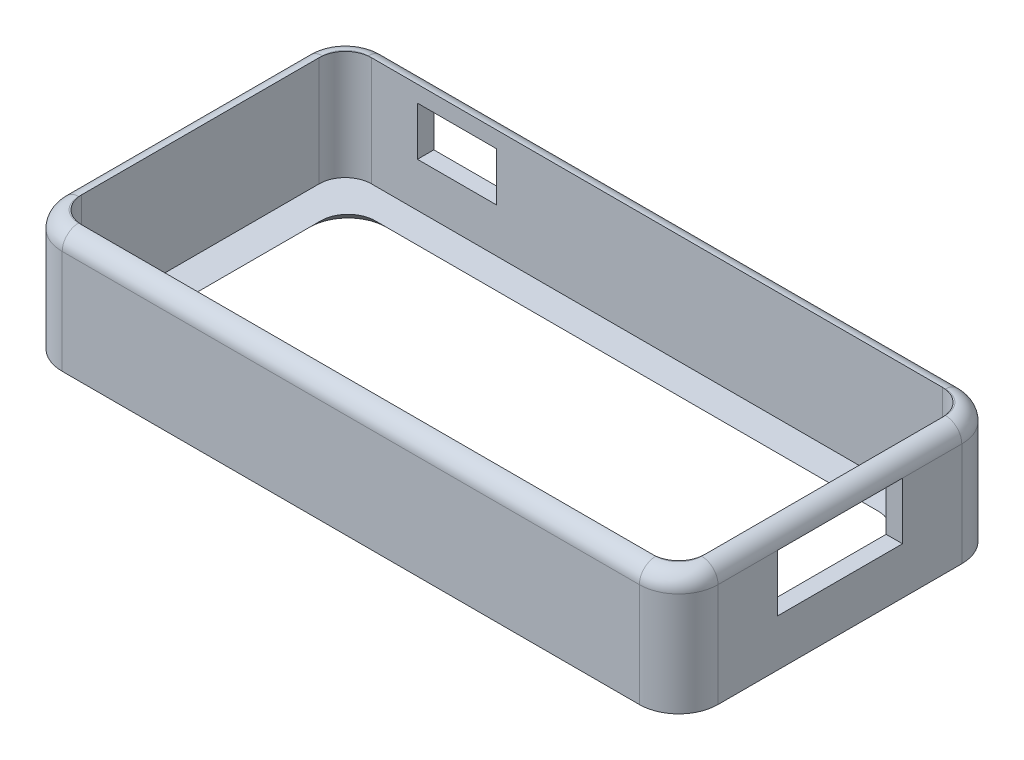
from build123d import *

# Parameters (mm, degrees)
SALIENTE_EXTRUIR2_DEPTH = 22
SALIENTE_EXTRUIR3_DEPTH = 2
CORTAR_EXTRUIR1_DEPTH   = 2
CHAFL_N1_SIZE           = 3
REDONDEO2_R             = 3
CROQUIS4_W              = 22.9
CROQUIS4_H              = 10.4
CORTAR_EXTRUIR2_DEPTH   = 10
CROQUIS5_W              = 14.5
CROQUIS5_H              = 8.9
CORTAR_EXTRUIR3_DEPTH   = 10


# Some blends are built 0.0001 mm under size
with BuildPart() as part:
    # Croquis1 → Saliente-Extruir2 (new body)
    with BuildSketch(Plane(origin=(0, 0, 0), x_dir=(1, 0, 0), z_dir=(0, 1, 0))):
        with BuildLine():
            Line((-52.8, 29.5), (52.8, 29.5))
            ThreePointArc((52.8, 29.5), (57.891168825, 27.391168825), (60, 22.3))
            Line((60, 22.3), (60, -22.3))
            ThreePointArc((60, -22.3), (57.891168825, -27.391168825), (52.8, -29.5))
            Line((52.8, -29.5), (-52.8, -29.5))
            ThreePointArc((-52.8, -29.5), (-57.891168825, -27.391168825), (-60, -22.3))
            Line((-60, -22.3), (-60, 22.3))
            ThreePointArc((-60, 22.3), (-57.891168825, 27.391168825), (-52.8, 29.5))
        make_face()
        with BuildLine():
            Line((-52.225351705, 26.5), (52.225351705, 26.5))
            ThreePointArc((52.225351705, 26.5), (55.601537892, 25.101537892), (57, 21.725351705))
            Line((57, 21.725351705), (57, -21.725351705))
            ThreePointArc((57, -21.725351705), (55.601537892, -25.101537892), (52.225351705, -26.5))
            Line((52.225351705, -26.5), (-52.225351705, -26.5))
            ThreePointArc((-52.225351705, -26.5), (-55.601537892, -25.101537892), (-57, -21.725351705))
            Line((-57, -21.725351705), (-57, 21.725351705))
            ThreePointArc((-57, 21.725351705), (-55.601537892, 25.101537892), (-52.225351705, 26.5))
        make_face(mode=Mode.SUBTRACT)
    extrude(amount=SALIENTE_EXTRUIR2_DEPTH)

    # Croquis2 → Saliente-Extruir3 (add)
    with BuildSketch(Plane.XZ):
        with BuildLine():
            Line((-60, 22.3), (-60, -22.3))
            ThreePointArc((-60, -22.3), (-57.891168825, -27.391168825), (-52.8, -29.5))
            Line((-52.8, -29.5), (52.8, -29.5))
            ThreePointArc((52.8, -29.5), (57.891168825, -27.391168825), (60, -22.3))
            Line((60, -22.3), (60, 22.3))
            ThreePointArc((60, 22.3), (57.891168825, 27.391168825), (52.8, 29.5))
            Line((52.8, 29.5), (-52.8, 29.5))
            ThreePointArc((-52.8, 29.5), (-57.891168825, 27.391168825), (-60, 22.3))
        make_face()
    extrude(amount=-SALIENTE_EXTRUIR3_DEPTH)

    # Croquis3 → Cortar-Extruir1 (cut)
    with BuildSketch(Plane(origin=(0, 2, 0), x_dir=(1, 0, 0), z_dir=(0, 1, 0))):
        with BuildLine():
            Line((-46, 20), (46, 20))
            ThreePointArc((46, 20), (48.828427125, 18.828427125), (50, 16))
            Line((50, 16), (50, -16))
            ThreePointArc((50, -16), (48.828427125, -18.828427125), (46, -20))
            Line((46, -20), (-46, -20))
            ThreePointArc((-46, -20), (-48.828427125, -18.828427125), (-50, -16))
            Line((-50, -16), (-50, 16))
            ThreePointArc((-50, 16), (-48.828427125, 18.828427125), (-46, 20))
        make_face()
    extrude(amount=-CORTAR_EXTRUIR1_DEPTH, mode=Mode.SUBTRACT)

    # Chaflán1
    # the kernel refuses this chamfer: 3 mm, written as the material it takes off along each edge
    with BuildSketch(Plane(origin=(-50, 0, 16), x_dir=(-0.9996219169112968, -0.02749587661058636, 0), z_dir=(0, 0, -1)), Plane(origin=(50, 0, -16), x_dir=(0.9996219169112968, -0.02749587661058636, 0), z_dir=(0, 0, 1))) as chafl_n1_piece_1:
        Polygon((CHAFL_N1_SIZE * 0.999621916911, CHAFL_N1_SIZE * 0.0274958766106), (-CHAFL_N1_SIZE * 0.0274958766106, CHAFL_N1_SIZE * 0.999621916911), (0, 0), align=None)
    extrude(amount=32, mode=Mode.SUBTRACT)
    with BuildSketch(Plane(origin=(-46, 0, 16), x_dir=(0, 0, 1), z_dir=(1, 0, 0))) as chafl_n1_piece_2:
        Polygon((4 + CHAFL_N1_SIZE, 0), (4, -CHAFL_N1_SIZE), (4, 0), align=None)
    revolve(axis=Axis((-46, 0, 16), (0, -1, 0)), revolution_arc=90, mode=Mode.SUBTRACT)
    with BuildSketch(Plane(origin=(-46, 0, -16), x_dir=(-1, 0, 0), z_dir=(0, 0, 1))) as chafl_n1_piece_3:
        Polygon((4 + CHAFL_N1_SIZE, 0), (4, -CHAFL_N1_SIZE), (4, 0), align=None)
    revolve(axis=Axis((-46, 0, -16), (0, -1, 0)), revolution_arc=90, mode=Mode.SUBTRACT)
    with BuildSketch(Plane(origin=(46, 0, 20), x_dir=(0, -0.02749587661058636, 0.9996219169112968), z_dir=(-1, 0, 0)), Plane(origin=(-46, 0, -20), x_dir=(0, -0.02749587661058636, -0.9996219169112968), z_dir=(1, 0, 0))) as chafl_n1_piece_4:
        Polygon((CHAFL_N1_SIZE * 0.999621916911, CHAFL_N1_SIZE * 0.0274958766106), (-CHAFL_N1_SIZE * 0.0274958766106, CHAFL_N1_SIZE * 0.999621916911), (0, 0), align=None)
    extrude(amount=92, mode=Mode.SUBTRACT)
    with BuildSketch(Plane(origin=(46, 0, 16), x_dir=(1, 0, 0), z_dir=(0, 0, -1))) as chafl_n1_piece_5:
        Polygon((4 + CHAFL_N1_SIZE, 0), (4, -CHAFL_N1_SIZE), (4, 0), align=None)
    revolve(axis=Axis((46, 0, 16), (0, -1, 0)), revolution_arc=90, mode=Mode.SUBTRACT)
    with BuildSketch(Plane(origin=(46, 0, -16), x_dir=(0, 0, -1), z_dir=(-1, 0, 0))) as chafl_n1_piece_6:
        Polygon((4 + CHAFL_N1_SIZE, 0), (4, -CHAFL_N1_SIZE), (4, 0), align=None)
    revolve(axis=Axis((46, 0, -16), (0, -1, 0)), revolution_arc=90, mode=Mode.SUBTRACT)

    # Redondeo2
    redondeo2_edges = [part.edges().sort_by_distance(p)[0] for p in [
        (57.891168825, 22, 27.391168825),
        (60, 22, 0),
        (57.891168825, 22, -27.391168825),
        (0, 22, -29.5),
        (-57.891168825, 22, -27.391168825),
        (-60, 22, 0),
        (-57.891168825, 22, 27.391168825),
        (0, 22, 29.5),
    ]]
    fillet(redondeo2_edges, radius=REDONDEO2_R - 0.0001)  # a hair under: the kernel refuses the full size

    # Croquis4 → Cortar-Extruir2 (cut)
    with BuildSketch(Plane(origin=(60, 0, 0), x_dir=(0, 0, -1), z_dir=(1, 0, 0))):
        with Locations((0, 13.8)):
            Rectangle(CROQUIS4_W, CROQUIS4_H)
    extrude(amount=-CORTAR_EXTRUIR2_DEPTH, mode=Mode.SUBTRACT)

    # Croquis5 → Cortar-Extruir3 (cut)
    with BuildSketch(Plane(origin=(0, 0, -29.5), x_dir=(-1, 0, 0), z_dir=(0, 0, -1))):
        with Locations((36.55, 14.55)):
            Rectangle(CROQUIS5_W, CROQUIS5_H)
    extrude(amount=-CORTAR_EXTRUIR3_DEPTH, mode=Mode.SUBTRACT)


solid = part.part
